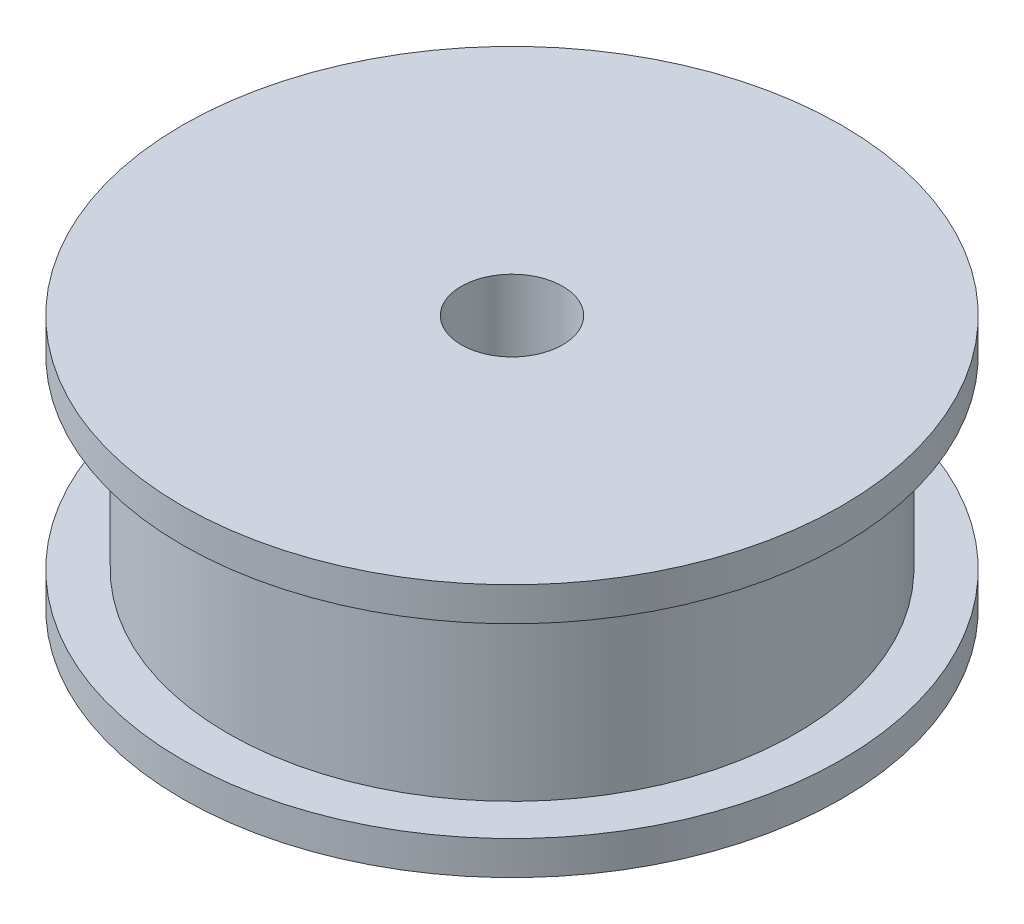
from build123d import *

# Parameters (mm, degrees)
SKETCH_2_R          = 3
CUT_EXTRUDE_1_DEPTH = 32.392674305


with BuildPart() as part:
    # 草图1 → 旋转1 (revolve)
    with BuildSketch(Plane.XY):
        Polygon((0, 0), (19.5, 0), (19.5, -2), (16.805, -2), (16.805, -13), (19.5, -13), (19.5, -15), (0, -15), align=None)
    revolve(axis=Axis((0, 23.575757576, 0), (0, -1, 0)))

    # 草图2 → 切除-拉伸1 (cut, through all)
    with BuildSketch(Plane(origin=(0, 0, 0), x_dir=(1, 0, 0), z_dir=(0, 1, 0))):
        Circle(SKETCH_2_R)
    extrude(amount=-CUT_EXTRUDE_1_DEPTH, mode=Mode.SUBTRACT)


solid = part.part
